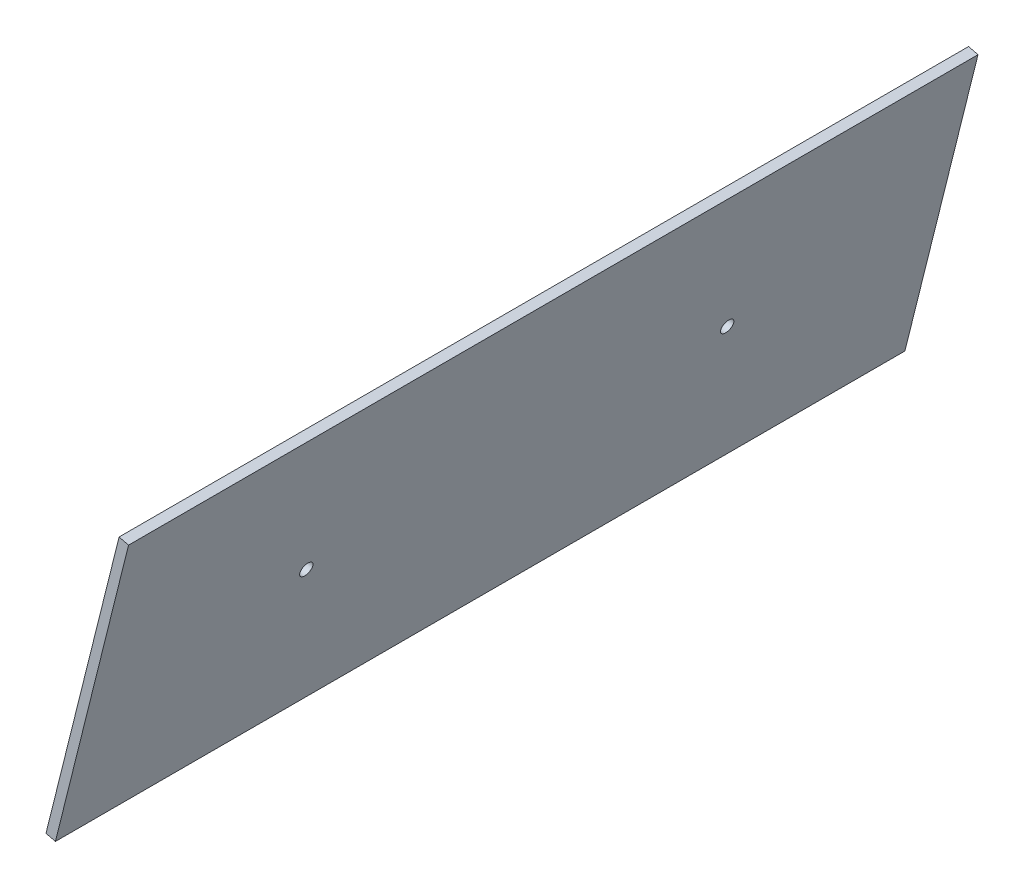
from build123d import *

# Parameters (mm, degrees)
BOSS_EXTRUDE1_DEPTH = 277.475
CUT_EXTRUDE1_REACH  = 284.517
SKETCH2_R           = 2.125


with BuildPart() as part:
    # Sketch1 → Boss-Extrude1 (new body)
    with BuildSketch(Plane.XY):
        Polygon((-37.629508919, -38.824877845), (-13.751817824, 56.943310339), (-16.832506755, 57.711412357), (-40.71019785, -38.056775826), align=None)
    extrude(amount=BOSS_EXTRUDE1_DEPTH)

    # Sketch2 → Cut-Extrude1 (cut, up to next)
    with BuildSketch(Plane(origin=(-26.313608582, 6.560719475, 0), x_dir=(0, 0, -1), z_dir=(0.9702957262759973, -0.24192189559966462, 0)), mode=Mode.PRIVATE) as cut_extrude1_sk1:
        with Locations((-207.475, 2.616835031)):
            Circle(SKETCH2_R)
    cut_extrude1_tool1 = extrude(cut_extrude1_sk1.sketch, amount=-CUT_EXTRUDE1_REACH, mode=Mode.PRIVATE) & part.part
    # Sketch2 → Cut-Extrude1 (cut, up to next)
    with BuildSketch(Plane(origin=(-26.313608582, 6.560719475, 0), x_dir=(0, 0, -1), z_dir=(0.9702957262759973, -0.24192189559966462, 0)), mode=Mode.PRIVATE) as cut_extrude1_sk2:
        with Locations((-70, 2.616835031)):
            Circle(SKETCH2_R)
    cut_extrude1_tool2 = extrude(cut_extrude1_sk2.sketch, amount=-CUT_EXTRUDE1_REACH, mode=Mode.PRIVATE) & part.part
    add(cut_extrude1_tool1.solids().sort_by_distance((-25.680539, 9.099823, 207.475))[0], mode=Mode.SUBTRACT)
    add(cut_extrude1_tool2.solids().sort_by_distance((-25.680539, 9.099823, 70))[0], mode=Mode.SUBTRACT)


solid = part.part
